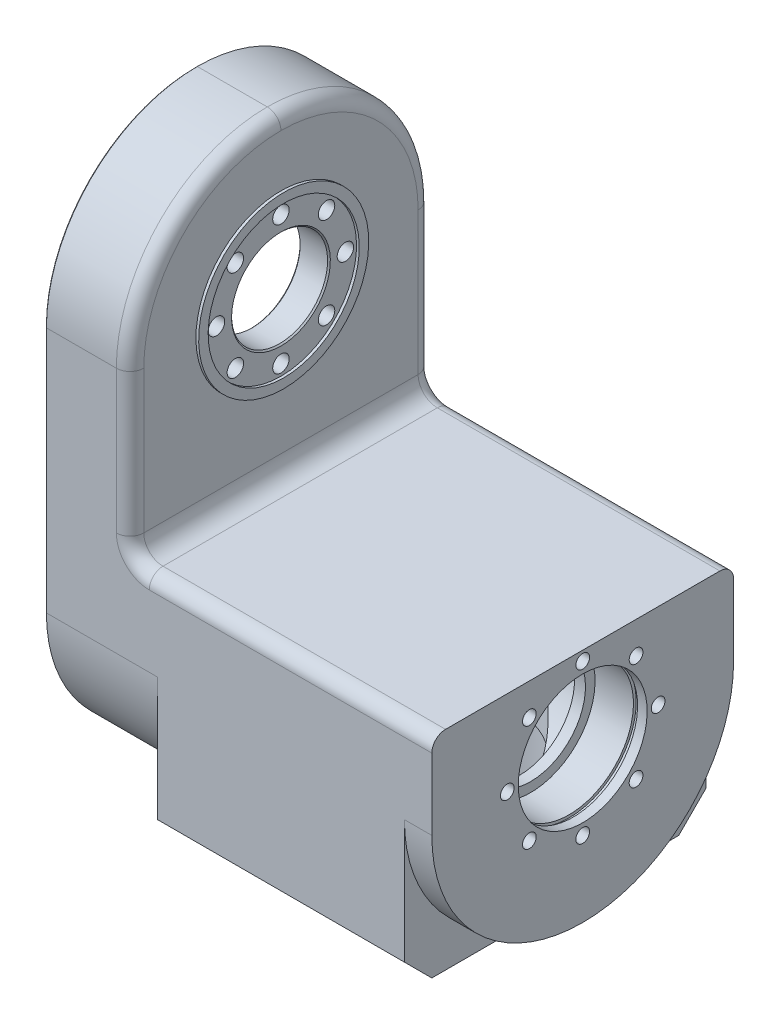
from build123d import *

# Parameters (mm, degrees)
SKETCH_1_W           = 141
SKETCH_1_H           = 200
EXTRUDE_1_DEPTH      = 110
FILLET_1_R           = 55
SKETCH_2_R           = 47.75
CUT_EXTRUDE_1_DEPTH  = 20
SKETCH_4_W           = 126.422893277
SKETCH_4_H           = 119.376822816
CUT_EXTRUDE_3_DEPTH  = 125
FILLET_4_R           = 55
SKETCH_9_R           = 47.75
CUT_EXTRUDE_4_DEPTH  = 20
SKETCH_10_W          = 95.5
SKETCH_10_H          = 90
CUT_EXTRUDE_5_DEPTH  = 20
SKETCH_11_R          = 17.5
CUT_EXTRUDE_6_DEPTH  = 25
CHAMFER_1_SIZE       = 0.5
SKETCH_16_R          = 27.5
CUT_EXTRUDE_12_DEPTH = 165
FILLET_6_R           = 7
SKETCH_17_W          = 110
SKETCH_17_H          = 55
EXTRUDE_2_DEPTH      = 90
SKETCH_18_R          = 27.5
CUT_EXTRUDE_13_DEPTH = 259.342795526
SKETCH_19_R          = 30
CUT_EXTRUDE_14_DEPTH = 50
SKETCH_21_R          = 3
CUT_EXTRUDE_16_DEPTH = 30
SKETCH_22_R          = 5
CUT_EXTRUDE_17_DEPTH = 6
SKETCH_24_R          = 31
SKETCH_24_R_2        = 27.55
EXTRUDE_3_DEPTH      = 1
SKETCH_26_R          = 2
CUT_EXTRUDE_19_DEPTH = 15
SKETCH_27_R          = 31
CUT_EXTRUDE_20_DEPTH = 10
EXTRUDE_START        = -23
SKETCH_28_R          = 27.5
SKETCH_28_R_2        = 23.5
EXTRUDE_4_DEPTH      = 23
SKETCH_30_R          = 23.5
SKETCH_30_R_2        = 20
EXTRUDE_5_DEPTH      = 4
SKETCH_31_R          = 24.5
SKETCH_31_R_2        = 23.5
CUT_EXTRUDE_21_DEPTH = 1.5
SKETCH_32_R          = 34
CUT_EXTRUDE_22_DEPTH = 25
SKETCH_33_R          = 2.5
CUT_EXTRUDE_23_DEPTH = 15
CHAMFER_2_SIZE       = 10
SKETCH_34_R          = 2.5
CUT_EXTRUDE_24_DEPTH = 15
FILLET_7_R           = 5
SKETCH_39_R          = 5
CUT_EXTRUDE_29_DEPTH = 15
SKETCH_40_R          = 2
CUT_EXTRUDE_30_DEPTH = 15
CHAMFER_3_SIZE       = 0.5
CHAMFER_4_SIZE       = 0.5
CHAMFER_5_SIZE       = 0.5
SKETCH_43_R          = 5
CUT_EXTRUDE_32_DEPTH = 10


with BuildPart() as part:
    # 草图1 → 拉伸1 (new body)
    with BuildSketch(Plane.XY):
        with Locations((70.5, -100)):
            Rectangle(SKETCH_1_W, SKETCH_1_H)
    extrude(amount=EXTRUDE_1_DEPTH)

    # 圆角1
    fillet_1_edges = [part.edges().sort_by_distance(p)[0] for p in [
        (70.5, 0, 0),
        (70.5, 0, 110),
    ]]
    fillet(fillet_1_edges, radius=FILLET_1_R - 0.0001)  # a hair under: the kernel refuses the full size

    # 草图2 → 切除-拉伸1 (cut)
    with BuildSketch(Plane.ZY):
        with Locations(Location((55, -55, 0), (0, 0, 270))):
            Circle(SKETCH_2_R)
    extrude(amount=-CUT_EXTRUDE_1_DEPTH, mode=Mode.SUBTRACT)

    # 草图4 → 切除-拉伸3 (cut)
    with BuildSketch(Plane.XY.offset(110)):
        with Locations((94.211446639, -54.311588592)):
            Rectangle(SKETCH_4_W, SKETCH_4_H)
    extrude(amount=-CUT_EXTRUDE_3_DEPTH, mode=Mode.SUBTRACT)

    # 圆角4
    fillet_4_edges = [part.edges().sort_by_distance(p)[0] for p in [
        (70.5, -200, 110),
        (70.5, -200, 0),
    ]]
    fillet(fillet_4_edges, radius=FILLET_4_R - 0.0001)  # a hair under: the kernel refuses the full size

    # 草图9 → 切除-拉伸4 (cut)
    with BuildSketch(Plane.ZY):
        with Locations((55, -145)):
            Circle(SKETCH_9_R)
    extrude(amount=-CUT_EXTRUDE_4_DEPTH, mode=Mode.SUBTRACT)

    # 草图10 → 切除-拉伸5 (cut)
    with BuildSketch(Plane.ZY):
        with Locations((55, -100)):
            Rectangle(SKETCH_10_W, SKETCH_10_H)
    extrude(amount=-CUT_EXTRUDE_5_DEPTH, mode=Mode.SUBTRACT)

    # 草图11 → 切除-拉伸6 (cut)
    with BuildSketch(Plane.ZY.offset(-20)):
        with Locations(Location((55, -55, 0), (0, 0, 270))):
            Circle(SKETCH_11_R)
    extrude(amount=-CUT_EXTRUDE_6_DEPTH, mode=Mode.SUBTRACT)

    # 倒角1
    chamfer_1_edges = [part.edges().sort_by_distance(p)[0] for p in [
        (0, -100, 0),
        (0, -100, 110),
        (0, -16.109097745, 93.890902255),
        (0, -16.109097745, 16.109097745),
        (0, -183.890902255, 16.109097745),
        (0, -183.890902255, 93.890902255),
    ]]
    chamfer(chamfer_1_edges, length=CHAMFER_1_SIZE)

    # 草图16 → 切除-拉伸12 (cut)
    with BuildSketch(Plane.ZY.offset(-20)):
        with Locations(Location((55, -145, 0), (0, 0, 270))):
            Circle(SKETCH_16_R)
    extrude(amount=-CUT_EXTRUDE_12_DEPTH, mode=Mode.SUBTRACT)

    # 圆角6
    fillet_6_edges = [part.edges().sort_by_distance(p)[0] for p in [
        (31, -114, 55),
    ]]
    fillet(fillet_6_edges, radius=FILLET_6_R)

    # 草图17 → 拉伸2 (add)
    with BuildSketch(Plane(origin=(131, 0, 0), x_dir=(0, 0, -1), z_dir=(1, 0, 0))):
        with Locations((-55, -172.5)):
            Rectangle(SKETCH_17_W, SKETCH_17_H)
    extrude(amount=-EXTRUDE_2_DEPTH)

    # 草图18 → 切除-拉伸13 (cut, through all)
    with BuildSketch(Plane.ZY.offset(-20)):
        with Locations(Location((55, -145, 0), (0, 0, 270))):
            Circle(SKETCH_18_R)
    extrude(amount=-CUT_EXTRUDE_13_DEPTH, mode=Mode.SUBTRACT)

    # 草图19 → 切除-拉伸14 (cut)
    with BuildSketch(Plane.XZ.offset(200)):
        with Locations((86, 55)):
            Circle(SKETCH_19_R)
    extrude(amount=-CUT_EXTRUDE_14_DEPTH, mode=Mode.SUBTRACT)

    # 草图21 → 切除-拉伸16 (cut)
    with BuildSketch(Plane.ZY.offset(-20)):
        with Locations(Location((55, -31.5, 0), (0, 0, 270))):
            Circle(SKETCH_21_R)
        with Locations(Location((71.617009358, -38.382990642, 0), (0, 0, 270))):
            Circle(SKETCH_21_R)
        with Locations(Location((78.5, -55, 0), (0, 0, 270))):
            Circle(SKETCH_21_R)
        with Locations(Location((71.617009358, -71.617009358, 0), (0, 0, 270))):
            Circle(SKETCH_21_R)
        with Locations(Location((55, -78.5, 0), (0, 0, 270))):
            Circle(SKETCH_21_R)
        with Locations(Location((38.382990642, -71.617009358, 0), (0, 0, 270))):
            Circle(SKETCH_21_R)
        with Locations(Location((31.5, -55, 0), (0, 0, 270))):
            Circle(SKETCH_21_R)
        with Locations(Location((38.382990642, -38.382990642, 0), (0, 0, 270))):
            Circle(SKETCH_21_R)
    extrude(amount=-CUT_EXTRUDE_16_DEPTH, mode=Mode.SUBTRACT)

    # 草图22 → 切除-拉伸17 (cut)
    with BuildSketch(Plane.ZY.offset(-20)):
        with Locations(Location((55, -31.5, 0), (0, 0, 270))):
            Circle(SKETCH_22_R)
        with Locations(Location((71.617009358, -38.382990642, 0), (0, 0, 270))):
            Circle(SKETCH_22_R)
        with Locations(Location((78.5, -55, 0), (0, 0, 270))):
            Circle(SKETCH_22_R)
        with Locations(Location((71.617009358, -71.617009358, 0), (0, 0, 270))):
            Circle(SKETCH_22_R)
        with Locations(Location((55, -78.5, 0), (0, 0, 270))):
            Circle(SKETCH_22_R)
        with Locations(Location((38.382990642, -71.617009358, 0), (0, 0, 270))):
            Circle(SKETCH_22_R)
        with Locations(Location((31.5, -55, 0), (0, 0, 270))):
            Circle(SKETCH_22_R)
        with Locations(Location((38.382990642, -38.382990642, 0), (0, 0, 270))):
            Circle(SKETCH_22_R)
    extrude(amount=-CUT_EXTRUDE_17_DEPTH, mode=Mode.SUBTRACT)

    # 草图24 → 拉伸3 (add)
    with BuildSketch(Plane(origin=(31, 0, 0), x_dir=(0, 0, -1), z_dir=(1, 0, 0))):
        with Locations(Location((-55, -55, 0), (0, 0, 270))):
            Circle(SKETCH_24_R)
        with Locations(Location((-55, -55, 0), (0, 0, 90))):
            Circle(SKETCH_24_R_2, mode=Mode.SUBTRACT)
    extrude(amount=EXTRUDE_3_DEPTH)

    # 草图26 → 切除-拉伸19 (cut)
    with BuildSketch(Plane.ZY):
        with Locations(Location((106, -145, 0), (0, 0, 180))):
            Circle(SKETCH_26_R)
        with Locations(Location((106, -55, 0), (0, 0, 180))):
            Circle(SKETCH_26_R)
        with Locations((55, -4)):
            Circle(SKETCH_26_R)
        with Locations((4, -55)):
            Circle(SKETCH_26_R)
        with Locations((4, -145)):
            Circle(SKETCH_26_R)
        with Locations((55, -196)):
            Circle(SKETCH_26_R)
    extrude(amount=-CUT_EXTRUDE_19_DEPTH, mode=Mode.SUBTRACT)

    # 草图27 → 切除-拉伸20 (cut)
    with BuildSketch(Plane.ZY.offset(-20)):
        with Locations(Location((55, -145, 0), (0, 0, 270))):
            Circle(SKETCH_27_R)
    extrude(amount=-CUT_EXTRUDE_20_DEPTH, mode=Mode.SUBTRACT)

    # 草图28 → 拉伸4 (add)
    with BuildSketch(Plane(origin=(141, 0, 0), x_dir=(0, 0, -1), z_dir=(1, 0, 0)).offset(EXTRUDE_START)):
        with Locations(Location((-55, -145, 0), (0, 0, 270))):
            Circle(SKETCH_28_R)
        with Locations(Location((-55, -145, 0), (0, 0, 90))):
            Circle(SKETCH_28_R_2, mode=Mode.SUBTRACT)
    extrude(amount=EXTRUDE_4_DEPTH)

    # 草图30 → 拉伸5 (add)
    with BuildSketch(Plane.ZY.offset(-118)):
        with Locations(Location((55, -145, 0), (0, 0, 90))):
            Circle(SKETCH_30_R)
        with Locations(Location((55, -145, 0), (0, 0, 270))):
            Circle(SKETCH_30_R_2, mode=Mode.SUBTRACT)
    extrude(amount=-EXTRUDE_5_DEPTH)

    # 草图31 → 切除-拉伸21 (cut)
    with BuildSketch(Plane(origin=(136, 0, 0), x_dir=(0, 0, -1), z_dir=(1, 0, 0))):
        with Locations(Location((-55, -145, 0), (0, 0, 90))):
            Circle(SKETCH_31_R)
        with Locations(Location((-55, -145, 0), (0, 0, 90))):
            Circle(SKETCH_31_R_2, mode=Mode.SUBTRACT)
    extrude(amount=CUT_EXTRUDE_21_DEPTH, mode=Mode.SUBTRACT)

    # 草图32 → 切除-拉伸22 (cut)
    with BuildSketch(Plane.XZ.offset(200)):
        with Locations((86, 55)):
            Circle(SKETCH_32_R)
    extrude(amount=-CUT_EXTRUDE_22_DEPTH, mode=Mode.SUBTRACT)

    # 草图33 → 切除-拉伸23 (cut)
    with BuildSketch(Plane.XZ.offset(200)):
        with Locations((86, 95)):
            Circle(SKETCH_33_R)
        with Locations((114.284271247, 83.284271247)):
            Circle(SKETCH_33_R)
        with Locations((126, 55)):
            Circle(SKETCH_33_R)
        with Locations((114.284271247, 26.715728753)):
            Circle(SKETCH_33_R)
        with Locations((86, 15)):
            Circle(SKETCH_33_R)
        with Locations((57.715728753, 26.715728753)):
            Circle(SKETCH_33_R)
        with Locations((46, 55)):
            Circle(SKETCH_33_R)
        with Locations((57.715728753, 83.284271247)):
            Circle(SKETCH_33_R)
    extrude(amount=-CUT_EXTRUDE_23_DEPTH, mode=Mode.SUBTRACT)

    # 倒角2
    chamfer_2_edges = [part.edges().sort_by_distance(p)[0] for p in [
        (86, -200, 0),
        (86, -200, 110),
    ]]
    chamfer(chamfer_2_edges, length=CHAMFER_2_SIZE)

    # 草图34 → 切除-拉伸24 (cut)
    with BuildSketch(Plane(origin=(141, 0, 0), x_dir=(0, 0, -1), z_dir=(1, 0, 0))):
        with Locations(Location((-55, -172.5, 0), (0, 0, 90))):
            Circle(SKETCH_34_R)
        with Locations(Location((-74.445436483, -164.445436483, 0), (0, 0, 90))):
            Circle(SKETCH_34_R)
        with Locations(Location((-82.5, -145, 0), (0, 0, 90))):
            Circle(SKETCH_34_R)
        with Locations(Location((-74.445436483, -125.554563517, 0), (0, 0, 90))):
            Circle(SKETCH_34_R)
        with Locations(Location((-55, -117.5, 0), (0, 0, 90))):
            Circle(SKETCH_34_R)
        with Locations(Location((-35.554563517, -125.554563517, 0), (0, 0, 90))):
            Circle(SKETCH_34_R)
        with Locations(Location((-27.5, -145, 0), (0, 0, 90))):
            Circle(SKETCH_34_R)
        with Locations(Location((-35.554563517, -164.445436483, 0), (0, 0, 90))):
            Circle(SKETCH_34_R)
    extrude(amount=-CUT_EXTRUDE_24_DEPTH, mode=Mode.SUBTRACT)

    # 圆角7
    fillet_7_edges = [part.edges().sort_by_distance(p)[0] for p in [
        (89.5, -114, 0),
        (89.5, -114, 110),
        (33.050252532, -111.949747468, 110),
        (33.050252532, -111.949747468, 0),
        (31, -16.109097745, 16.109097745),
        (31, -80.99995, 110),
        (31, -80.99995, 0),
        (31, -16.109097745, 93.890902255),
    ]]
    fillet(fillet_7_edges, radius=FILLET_7_R)

    # 草图39 → 切除-拉伸29 (cut)
    with BuildSketch(Plane(origin=(0, 0, 0), x_dir=(-1, 0, 0), z_dir=(0, 0, -1))):
        with Locations((-86, -145)):
            Circle(SKETCH_39_R)
    extrude(amount=-CUT_EXTRUDE_29_DEPTH, mode=Mode.SUBTRACT)

    # 草图40 → 切除-拉伸30 (cut)
    with BuildSketch(Plane(origin=(0, 0, 15), x_dir=(-1, 0, 0), z_dir=(0, 0, -1))):
        with Locations((-86, -145)):
            Circle(SKETCH_40_R)
    extrude(amount=-CUT_EXTRUDE_30_DEPTH, mode=Mode.SUBTRACT)

    # 倒角3
    chamfer_3_edges = [part.edges().sort_by_distance(p)[0] for p in [
        (52, -200, 55),
    ]]
    chamfer(chamfer_3_edges, length=CHAMFER_3_SIZE)

    # 倒角4
    chamfer_4_edges = [part.edges().sort_by_distance(p)[0] for p in [
        (20, -114, 55),
        (30, -117.5, 55),
    ]]
    chamfer(chamfer_4_edges, length=CHAMFER_4_SIZE)

    # 倒角5
    chamfer_5_edges = [part.edges().sort_by_distance(p)[0] for p in [
        (31, -37.5, 55),
        (20, -37.5, 55),
    ]]
    chamfer(chamfer_5_edges, length=CHAMFER_5_SIZE)

    # 草图43 → 切除-拉伸32 (cut)
    with BuildSketch(Plane(origin=(0, 0, 0), x_dir=(-1, 0, 0), z_dir=(0, 0, -1))):
        with Locations((-10, -100)):
            Circle(SKETCH_43_R)
    extrude(amount=-CUT_EXTRUDE_32_DEPTH, mode=Mode.SUBTRACT)


solid = part.part
